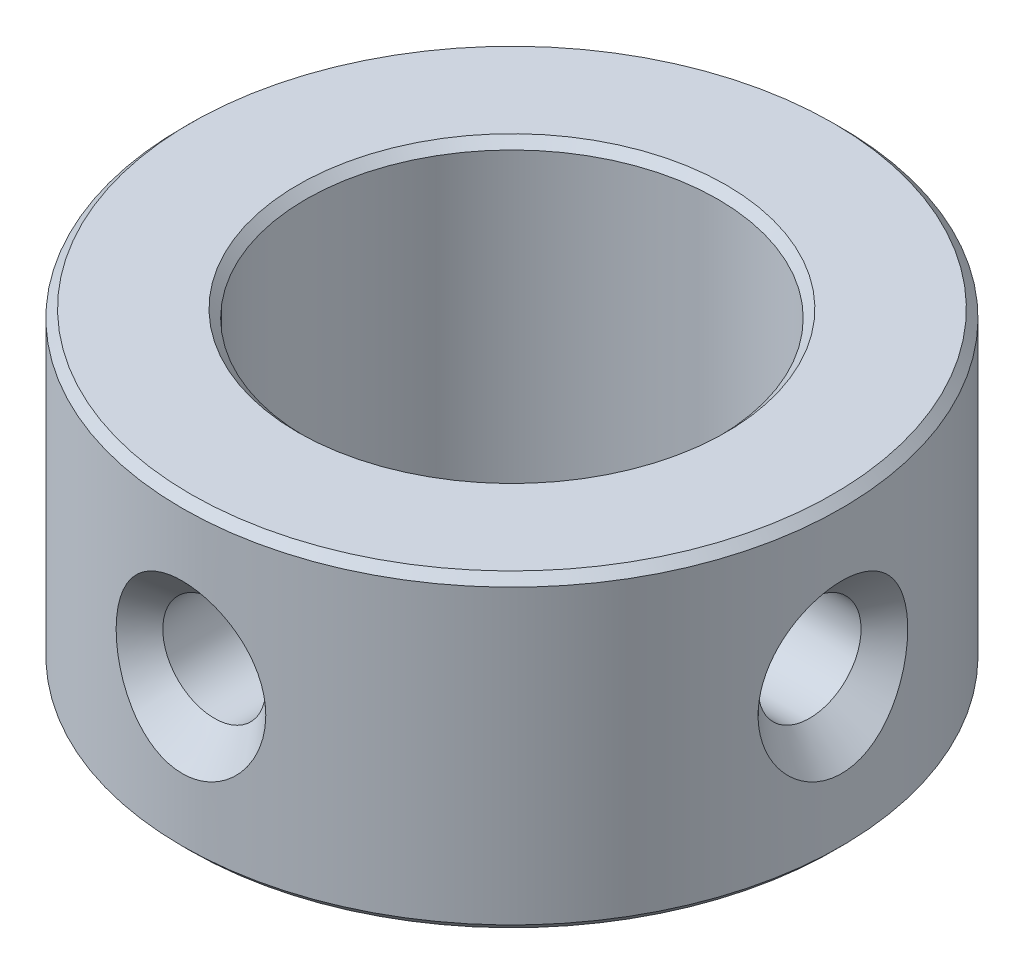
from build123d import *

# Parameters (mm, degrees)
PROFILE_SKETCH_R                 = 8
PROFILE_SKETCH_R_2               = 5
PROFILE_DEPTH                    = 3.75
SET_SCREW_CIRCULAR_PATTERN_COUNT = 2
SET_SCREW_CIRCULAR_PATTERN_ANGLE = 90
OUTER_CHAMFER_SIZE               = 0.2
INNER_CHAMFER_SIZE               = 0.2


# Read off the part's stored shape, not the designer's step:  Tapped Hole1
with BuildPart() as part:
    # Profile Sketch → Profile (new, symmetric)
    with BuildSketch(Plane(origin=(0, 0, 0), x_dir=(1, 0, 0), z_dir=(0, 1, 0))):
        with Locations(Location((0, 0, 0), (0, 0, 270))):
            Circle(PROFILE_SKETCH_R)
        with Locations(Location((0, 0, 0), (0, 0, 270))):
            Circle(PROFILE_SKETCH_R_2, mode=Mode.SUBTRACT)
    extrude(amount=PROFILE_DEPTH, both=True)

    # Tapped Hole1 outline → Tapped Hole1 (revolve, cut)
    with BuildSketch(Plane.XZ):
        Polygon((2.025000231, 8.000000231), (0, 8.000000231), (0, 4.841160984), (1.25, 4.841160984), (1.25, 7.225), align=None)
    tapped_hole1 = revolve(axis=Axis((0, 0, 0), (0, 0, 1)), mode=Mode.SUBTRACT)

    # Set Screw Circular Pattern: Tapped Hole1 ×2 about axis
    set_screw_circular_pattern_axis = Axis((0, 3.75, 0), (0, 1, 0))
    for i in range(1, SET_SCREW_CIRCULAR_PATTERN_COUNT):
        add(tapped_hole1.rotate(set_screw_circular_pattern_axis, i * SET_SCREW_CIRCULAR_PATTERN_ANGLE / (SET_SCREW_CIRCULAR_PATTERN_COUNT - 1)), mode=Mode.SUBTRACT)

    # Outer Chamfer
    outer_chamfer_edges = [part.edges().sort_by_distance(p)[0] for p in [
        (0, -3.75, -8),
        (0, 3.75, -8),
    ]]
    chamfer(outer_chamfer_edges, length=OUTER_CHAMFER_SIZE)

    # Inner Chamfer
    inner_chamfer_edges = [part.edges().sort_by_distance(p)[0] for p in [
        (0, -3.75, -5),
        (0, 3.75, -5),
    ]]
    chamfer(inner_chamfer_edges, length=INNER_CHAMFER_SIZE)


solid = part.part
